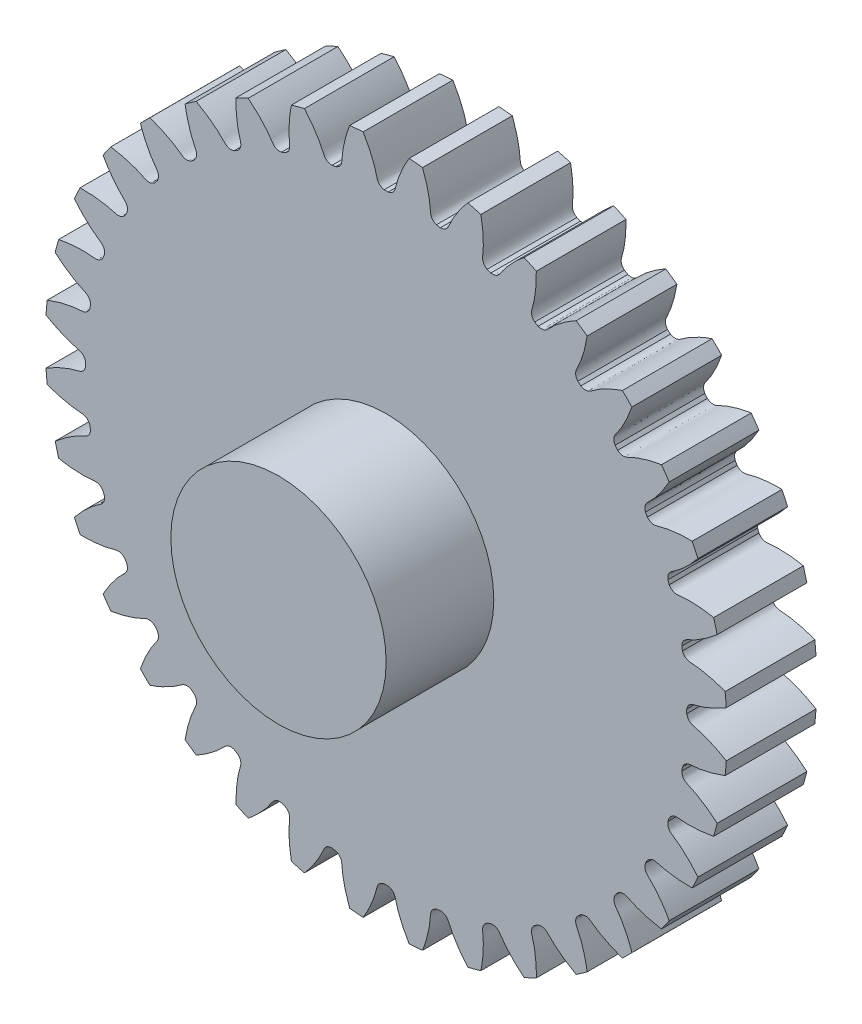
from build123d import *

# Parameters (mm, degrees)
SKETCH_1_R               = 9.5
EXTRUDE_1_DEPTH          = 2.5
CUT_EXTRUDE_1_DEPTH      = 14.665650369
PATTERN_CIRCULAR_1_COUNT = 36
SKETCH_4_R               = 3
EXTRUDE_2_DEPTH          = 3


with BuildPart() as part:
    # 草图1 → 凸台-拉伸1 (new body)
    with BuildSketch(Plane.XY):
        Circle(SKETCH_1_R)
    extrude(amount=EXTRUDE_1_DEPTH)

    # 草图2 → 切除-拉伸1 (cut, through all)
    with BuildSketch(Plane.XY):
        with BuildLine():
            ThreePointArc((0.054934474, 8.374819831), (0, 8.375), (-0.054934474, 8.374819831))
            add(Edge.make_bspline(
                [(-0.054934474, 8.374819831), (-0.234978953, 8.415201319), (-0.250497423, 8.549314662), (-0.288218357, 8.691373568), (-0.299748628, 8.731851177), (-0.31309989, 8.775314366), (-0.328367396, 8.821718829), (-0.34568221, 8.870999935), (-0.365162519, 8.923094297), (-0.386928046, 8.977933385), (-0.411095645, 9.035445483), (-0.437780475, 9.09555517), (-0.467095531, 9.15818354), (-0.499151661, 9.223248205), (-0.534057436, 9.290663368), (-0.571919068, 9.360339873), (-0.612840323, 9.432185269), (-0.656922424, 9.506103874), (-0.704263969, 9.581996838), (-0.754960844, 9.659762209), (-0.809106137, 9.739295006), (-0.866790057, 9.820487287), (-0.928099853, 9.903228226), (-0.993119734, 9.987404187), (-1.061930793, 10.072898798), (-1.134610932, 10.15959304), (-1.211234787, 10.247365317), (-1.291873657, 10.33609155), (-1.376595441, 10.425645255), (-1.46546454, 10.515897632), (-1.591181957, 10.63856609), (-1.689482035, 10.72881939), (-1.757006718, 10.78843362)],
                knots=[0, 0, 0, 0, 0.120371484, 0.133302531, 0.147363917, 0.16255564, 0.178877702, 0.196330101, 0.214912839, 0.234625915, 0.25546933, 0.277443082, 0.300547173, 0.324781601, 0.350146368, 0.376641473, 0.404266917, 0.433022698, 0.462908818, 0.493925275, 0.526072071, 0.559349205, 0.593756678, 0.629294488, 0.665962637, 0.703761124, 0.742689949, 0.782749112, 0.823938613, 0.866258453, 0.90970863, 1, 1, 1, 1], degree=3))
            ThreePointArc((-1.757006718, 10.78843362), (0, 10.930570551), (1.757006718, 10.78843362))
            add(Edge.make_bspline(
                [(0.054934474, 8.374819831), (0.234978953, 8.415201319), (0.250497423, 8.549314662), (0.288218357, 8.691373568), (0.299748628, 8.731851177), (0.31309989, 8.775314366), (0.328367396, 8.821718829), (0.34568221, 8.870999935), (0.365162519, 8.923094297), (0.386928046, 8.977933385), (0.411095645, 9.035445483), (0.437780475, 9.09555517), (0.467095531, 9.15818354), (0.499151661, 9.223248205), (0.534057436, 9.290663368), (0.571919068, 9.360339873), (0.612840323, 9.432185269), (0.656922424, 9.506103874), (0.704263969, 9.581996838), (0.754960844, 9.659762209), (0.809106137, 9.739295006), (0.866790057, 9.820487287), (0.928099853, 9.903228226), (0.993119734, 9.987404187), (1.061930793, 10.072898798), (1.134610932, 10.15959304), (1.211234787, 10.247365317), (1.291873657, 10.33609155), (1.376595441, 10.425645255), (1.46546454, 10.515897632), (1.591181957, 10.63856609), (1.689482035, 10.72881939), (1.757006718, 10.78843362)],
                knots=[0, 0, 0, 0, 0.120371484, 0.133302531, 0.147363917, 0.16255564, 0.178877702, 0.196330101, 0.214912839, 0.234625915, 0.25546933, 0.277443082, 0.300547173, 0.324781601, 0.350146368, 0.376641473, 0.404266917, 0.433022698, 0.462908818, 0.493925275, 0.526072071, 0.559349205, 0.593756678, 0.629294488, 0.665962637, 0.703761124, 0.742689949, 0.782749112, 0.823938613, 0.866258453, 0.90970863, 1, 1, 1, 1], degree=3))
        make_face()
    cut_extrude_1 = extrude(amount=CUT_EXTRUDE_1_DEPTH, mode=Mode.SUBTRACT)

    # 阵列(圆周)1: 切除-拉伸1 ×36 about axis
    pattern_circular_1_axis = Axis((0, 0, 2.5), (0, 0, -1))
    for i in range(1, PATTERN_CIRCULAR_1_COUNT):
        add(cut_extrude_1.rotate(pattern_circular_1_axis, i * 360 / PATTERN_CIRCULAR_1_COUNT), mode=Mode.SUBTRACT)

    # 草图4 → 凸台-拉伸2 (add)
    with BuildSketch(Plane.XY.offset(2.5)):
        Circle(SKETCH_4_R)
    extrude(amount=EXTRUDE_2_DEPTH)


solid = part.part
